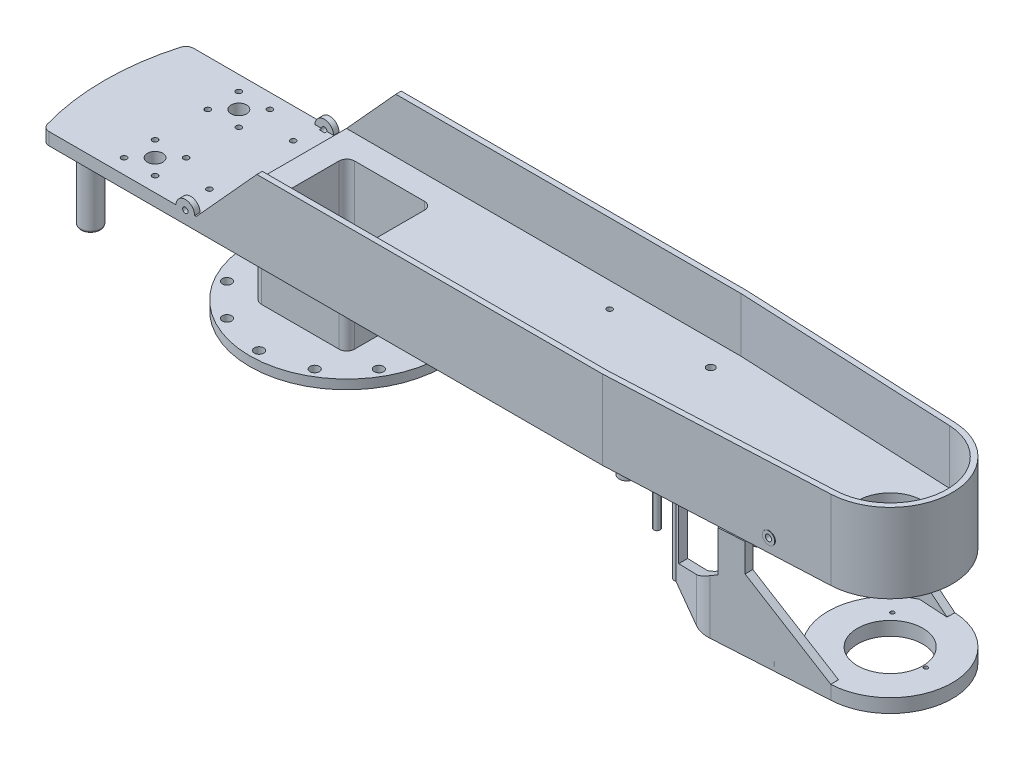
from build123d import *

# Parameters (mm, degrees)
BOSS_EXTRUDE1_DEPTH      = 16
SKETCH3_R                = 62.5
SKETCH3_R_2              = 48
EXTRUDE_THIN1_DEPTH      = 6
SKETCH4_R                = 48
BOSS_EXTRUDE2_DEPTH      = 3
BOSS_EXTRUDE3_REACH      = 399.256
SKETCH5_W                = 60
SKETCH5_H                = 60
FILLET1_R                = 5
SKETCH6_W                = 55
SKETCH6_H                = 55
CUT_EXTRUDE1_DEPTH       = 44
FILLET2_R                = 5
SKETCH7_R                = 26.5
CUT_EXTRUDE2_DEPTH       = 11.5
EXTRUDE_THIN2_DEPTH      = 35
CUT_EXTRUDE3_REACH       = 410.145
SKETCH10_R               = 1.75
CUT_EXTRUDE4_DEPTH       = 5
CUT_EXTRUDE5_REACH       = 407.892
SKETCH11_R               = 3
CIRPATTERN1_COUNT        = 12
BOSS_EXTRUDE4_DEPTH      = 3.5
SKETCH13_R               = 6.5
BOSS_EXTRUDE5_DEPTH      = 42.5
FILLET3_R                = 1.5
FILLET4_R                = 5
FILLET3_OF_MIRROR2_R     = 1.5
SKETCH14_R               = 25
CUT_EXTRUDE6_DEPTH       = 3.5
CUT_EXTRUDE7_REACH       = 399.822
SKETCH15_R               = 21
BOSS_EXTRUDE6_DEPTH      = 64
CUT_EXTRUDE8_DEPTH       = 401.127792086
CUT_EXTRUDE8_DEPTH_BACK  = 401.127792086
BOSS_EXTRUDE7_START      = -8.853542
SKETCH18_R               = 40
BOSS_EXTRUDE7_DEPTH      = 8.853542
SKETCH19_R               = 1
CUT_EXTRUDE9_DEPTH       = 6
CUT_EXTRUDE10_REACH      = 413.377
SKETCH20_R               = 21
CUT_EXTRUDE11_DEPTH      = 401.702508103
CUT_EXTRUDE11_DEPTH_BACK = 10
SKETCH21_R               = 1.25
BOSS_EXTRUDE8_DEPTH      = 2
BOSS_EXTRUDE8_DEPTH_BACK = 2
SKETCH23_R               = 9
SKETCH23_R_2             = 5
BOSS_EXTRUDE9_DEPTH      = 1
CUT_EXTRUDE13_REACH      = 403.485
SKETCH25_R               = 1.75
SKETCH26_R               = 5
BOSS_EXTRUDE10_DEPTH     = 0.8
FILLET6_R                = 5
SKETCH28_R               = 5
BOSS_EXTRUDE11_DEPTH     = 16
FILLET7_R                = 3
SKETCH29_R               = 1.75
CUT_EXTRUDE14_DEPTH      = 5
SKETCH30_R               = 2.5
BOSS_EXTRUDE12_DEPTH     = 16.8
FILLET8_R                = 1
CUT_EXTRUDE15_REACH      = 402.753
SKETCH31_R               = 1.75
CUT_EXTRUDE16_REACH      = 402.753
SKETCH32_R               = 2.5
SKETCH33_R               = 2
BOSS_EXTRUDE13_DEPTH     = 64
SKETCH34_R               = 1
CUT_EXTRUDE17_DEPTH      = 6
BOSS_EXTRUDE14_REACH     = 433.766
BOSS_EXTRUDE14_START     = -18
SKETCH35_R               = 4
SKETCH36_R               = 2
CUT_EXTRUDE18_DEPTH      = 4
SKETCH37_R               = 2
CUT_EXTRUDE19_DEPTH      = 2
MIRROR10_START           = -42
MIRROR10_OUTLINE_R       = 2
MIRROR10_DEPTH           = 4
MIRROR10_2_OUTLINE_R     = 4
MIRROR10_2_OUTLINE_R_2   = 2
MIRROR10_2_DEPTH         = 0.451198656
SKETCH38_R               = 5
CUT_EXTRUDE20_DEPTH      = 8


# Read off the part's stored shape, not the designer's step: Mirror10
with BuildPart() as part:
    # Sketch1 → Boss-Extrude1 (new body)
    with BuildSketch(Plane(origin=(0, 0, 0), x_dir=(1, 0, 0), z_dir=(0, 1, 0))):
        with BuildLine():
            Line((-148.90852897, 46.5), (211.09147103, 46.5))
            Line((211.09147103, 46.5), (351.857293256, 39.956857506))
            ThreePointArc((351.857293256, 39.956857506), (390, 0), (351.857293256, -39.956857506))
            Line((351.857293256, -39.956857506), (211.09147103, -46.5))
            Line((211.09147103, -46.5), (-148.90852897, -46.5))
            ThreePointArc((-148.90852897, -46.5), (-156, 0), (-148.90852897, 46.5))
        make_face()
    extrude(amount=BOSS_EXTRUDE1_DEPTH)


with BuildPart() as body_2:
    # Sketch3 → Extrude-Thin1 (new body)
    with BuildSketch(Plane(origin=(0, -36.5, 0), x_dir=(-1, 0, 0), z_dir=(0, -1, 0))):
        Circle(SKETCH3_R)
        Circle(SKETCH3_R_2, mode=Mode.SUBTRACT)
    extrude(amount=EXTRUDE_THIN1_DEPTH)

    # Sketch4 → Boss-Extrude2 (add)
    with BuildSketch(Plane(origin=(0, -36.5, 0), x_dir=(-1, 0, 0), z_dir=(0, -1, 0))):
        Circle(SKETCH4_R)
    extrude(amount=BOSS_EXTRUDE2_DEPTH)

    # Sketch5 → Boss-Extrude3 (add, up to next)
    with BuildSketch(Plane.XZ, mode=Mode.PRIVATE) as boss_extrude3_sk1:
        Rectangle(SKETCH5_W, SKETCH5_H)
    boss_extrude3_tool1 = extrude(boss_extrude3_sk1.sketch, amount=BOSS_EXTRUDE3_REACH, mode=Mode.PRIVATE) - body_2.part

    add(part.part)  # Boss-Extrude3 merges part
    add(boss_extrude3_tool1.solids().sort_by_distance((0, 0, 0))[0])

    # Fillet1
    fillet1_edges = [body_2.edges().sort_by_distance(p)[0] for p in [
        (30, -18.25, -30),
        (30, -18.25, 30),
        (-30, -18.25, 30),
        (-30, -18.25, -30),
    ]]
    fillet(fillet1_edges, radius=FILLET1_R)

    # Sketch6 → Cut-Extrude1 (cut)
    with BuildSketch(Plane(origin=(0, 16, 0), x_dir=(1, 0, 0), z_dir=(0, 1, 0))):
        Rectangle(SKETCH6_W, SKETCH6_H)
    extrude(amount=-CUT_EXTRUDE1_DEPTH, mode=Mode.SUBTRACT)

    # Fillet2
    fillet2_edges = [body_2.edges().sort_by_distance(p)[0] for p in [
        (27.5, -6, -27.5),
        (27.5, -6, 27.5),
        (-27.5, -6, 27.5),
        (-27.5, -6, -27.5),
    ]]
    fillet(fillet2_edges, radius=FILLET2_R)

    # Sketch7 → Cut-Extrude2 (cut)
    with BuildSketch(Plane.XZ.offset(39.5)):
        with Locations(Location((0, 0, 0), (0, 0, 270))):
            Circle(SKETCH7_R)
    extrude(amount=-CUT_EXTRUDE2_DEPTH, mode=Mode.SUBTRACT)

    # Sketch8 → Extrude-Thin2 (add)
    with BuildSketch(Plane(origin=(0, 16, 0), x_dir=(1, 0, 0), z_dir=(0, 1, 0))):
        with BuildLine():
            Line((351.857293256, 39.956857506), (211.09147103, 46.5))
            Line((211.09147103, 46.5), (-148.90852897, 46.5))
            ThreePointArc((-148.90852897, 46.5), (-156, 0), (-148.90852897, -46.5))
            Line((-148.90852897, -46.5), (211.09147103, -46.5))
            Line((211.09147103, -46.5), (351.857293256, -39.956857506))
            ThreePointArc((351.857293256, -39.956857506), (390, 0), (351.857293256, 39.956857506))
        make_face()
        with BuildLine():
            Line((351.694780096, 36.460632474), (211.010170606, 43))
            Line((211.010170606, 43), (-146.312166275, 43))
            ThreePointArc((-146.312166275, 43), (-152.5, 0), (-146.312166275, -43))
            Line((-146.312166275, -43), (211.010170606, -43))
            Line((211.010170606, -43), (351.694780096, -36.460632474))
            ThreePointArc((351.694780096, -36.460632474), (386.5, 0), (351.694780096, 36.460632474))
        make_face(mode=Mode.SUBTRACT)
    extrude(amount=EXTRUDE_THIN2_DEPTH)

    # Cut-Extrude3: up to this face of the body (flat: up to its plane)
    cut_extrude3_end = Plane(body_2.part.faces().sort_by_distance((31.09147103, 25.5, -46.5))[0])
    # Sketch9 → Cut-Extrude3 (cut, up to the picked face)
    with BuildSketch(Plane.XY.offset(46.5), mode=Mode.PRIVATE) as cut_extrude3_sk1:
        Polygon((-170.64581718, 8), (-50.48, 8), (5.323980372, 69.435391219), (-170.64581718, 69.435391219), align=None)
    cut_extrude3_tool1 = split(extrude(cut_extrude3_sk1.sketch, amount=-CUT_EXTRUDE3_REACH, mode=Mode.PRIVATE), bisect_by=cut_extrude3_end, keep=Keep.BOTH, mode=Mode.PRIVATE)
    add(cut_extrude3_tool1.solids().sort_by(Axis((-95.735602, 40.647183, 46.5), (0, 0, -1)))[0], mode=Mode.SUBTRACT)

    # Sketch10 → Cut-Extrude4 (cut)
    with BuildSketch(Plane(origin=(0, -28, 0), x_dir=(1, 0, 0), z_dir=(0, 1, 0))):
        with Locations(Location((21, 21, 0), (0, 0, 270))):
            Circle(SKETCH10_R)
        with Locations(Location((21, -21, 0), (0, 0, 270))):
            Circle(SKETCH10_R)
        with Locations(Location((-21, -21, 0), (0, 0, 270))):
            Circle(SKETCH10_R)
        with Locations(Location((-21, 21, 0), (0, 0, 270))):
            Circle(SKETCH10_R)
    extrude(amount=-CUT_EXTRUDE4_DEPTH, mode=Mode.SUBTRACT)

    # Sketch11 → Cut-Extrude5 (cut, up to next)
    with BuildSketch(Plane.XZ.offset(42.5), mode=Mode.PRIVATE) as cut_extrude5_sk1:
        with Locations(Location((56.5, 0, 0), (0, 0, 270))):
            Circle(SKETCH11_R)
    cut_extrude5_tool1 = extrude(cut_extrude5_sk1.sketch, amount=-CUT_EXTRUDE5_REACH, mode=Mode.PRIVATE) & body_2.part
    cut_extrude5 = cut_extrude5_tool1.solids().sort_by_distance((56.5, -42.5, 0))[0]
    add(cut_extrude5, mode=Mode.SUBTRACT)

    # CirPattern1: Cut-Extrude5 ×12 about axis
    cirpattern1_axis = Axis((0, 0, 0), (0, 1, 0))
    for i in range(1, CIRPATTERN1_COUNT):
        add(cut_extrude5.rotate(cirpattern1_axis, i * 360 / CIRPATTERN1_COUNT), mode=Mode.SUBTRACT)

    # Sketch12 → Boss-Extrude4 (add)
    with BuildSketch(Plane.XY.offset(46.5)):
        with BuildLine():
            Line((-63.5, 8), (-51.5, 8))
            ThreePointArc((-51.5, 8), (-57.5, 14), (-63.5, 8))
        make_face()
    boss_extrude4 = extrude(amount=-BOSS_EXTRUDE4_DEPTH)

    # Mirror1: Boss-Extrude4 across plane
    add(boss_extrude4.mirror(Plane.XY))

    # Sketch13 → Boss-Extrude5 (add)
    with BuildSketch(Plane.XZ):
        with Locations(Location((-130, 35, 0), (0, 0, 90))):
            Circle(SKETCH13_R)
    boss_extrude5 = extrude(amount=BOSS_EXTRUDE5_DEPTH)

    # Fillet3
    fillet3_edges = [body_2.edges().sort_by_distance(p)[0] for p in [
        (-130, -42.5, 28.5),
    ]]
    fillet(fillet3_edges, radius=FILLET3_R)

    # Fillet4
    fillet4_edges = [body_2.edges().sort_by_distance(p)[0] for p in [
        (-148.90852897, 4, -46.5),
        (-148.90852897, 4, 46.5),
    ]]
    fillet(fillet4_edges, radius=FILLET4_R)

    # Mirror2: Boss-Extrude5 across plane
    add(boss_extrude5.mirror(Plane.XY))

    # Fillet3 of Mirror2
    fillet3_of_mirror2_edges = [body_2.edges().sort_by_distance(p)[0] for p in [
        (-130, -42.5, -28.5),
    ]]
    fillet(fillet3_of_mirror2_edges, radius=FILLET3_OF_MIRROR2_R)

    # Sketch14 → Cut-Extrude6 (cut)
    with BuildSketch(Plane.XZ):
        with Locations(Location((350, 0, 0), (0, 0, 270))):
            Circle(SKETCH14_R)
    extrude(amount=-CUT_EXTRUDE6_DEPTH, mode=Mode.SUBTRACT)

    # Sketch15 → Cut-Extrude7 (cut, up to next)
    with BuildSketch(Plane.XZ.offset(-3.5), mode=Mode.PRIVATE) as cut_extrude7_sk1:
        with Locations(Location((350, 0, 0), (0, 0, 270))):
            Circle(SKETCH15_R)
    cut_extrude7_tool1 = extrude(cut_extrude7_sk1.sketch, amount=-CUT_EXTRUDE7_REACH, mode=Mode.PRIVATE) & body_2.part
    add(cut_extrude7_tool1.solids().sort_by_distance((350, 3.5, 0))[0], mode=Mode.SUBTRACT)

    # Sketch16 → Boss-Extrude6 (add)
    with BuildSketch(Plane.XZ):
        with BuildLine():
            Line((351.857293256, 39.956857506), (278.143743734, 44.309161633))
            ThreePointArc((278.143743734, 44.309161633), (272.360368874, 43.806666785), (266.964927199, 41.664440144))
            Line((266.964927199, 41.664440144), (235.621320344, 23.568200289))
            ThreePointArc((235.621320344, 23.568200289), (231.718911087, 18.428391908), (238.121320344, 19.23807327))
            Line((238.121320344, 19.23807327), (268.166690967, 36.584776088))
            ThreePointArc((268.166690967, 36.584776088), (273.562132642, 38.727002728), (279.345507503, 39.229497577))
            Line((279.345507503, 39.229497577), (351.562589122, 34.965550115))
            Line((351.562589122, 34.965550115), (351.857293256, 39.956857506))
        make_face()
        with BuildLine():
            Line((351.857293256, -39.956857506), (351.562589122, -34.965550115))
            Line((351.562589122, -34.965550115), (279.345507503, -39.229497577))
            ThreePointArc((279.345507503, -39.229497577), (273.562132642, -38.727002728), (268.166690967, -36.584776088))
            Line((268.166690967, -36.584776088), (238.121320344, -19.23807327))
            ThreePointArc((238.121320344, -19.23807327), (231.718911087, -18.428391908), (235.621320344, -23.568200289))
            Line((235.621320344, -23.568200289), (266.964927199, -41.664440144))
            ThreePointArc((266.964927199, -41.664440144), (272.360368874, -43.806666785), (278.143743734, -44.309161633))
            Line((278.143743734, -44.309161633), (351.857293256, -39.956857506))
        make_face()
    extrude(amount=BOSS_EXTRUDE6_DEPTH)

    # Sketch17 → Cut-Extrude8 (cut, two sides: drawn at the far end of the back side and taken through both)
    with BuildSketch(Plane.XY.offset(-CUT_EXTRUDE8_DEPTH_BACK)):
        Polygon((299.57623477, 0), (368.485150603, 0), (368.485150603, -55.251157242), (351.857293256, -55.251157242), (299.57623477, -18.10349372), align=None)
        Polygon((239.768496501, 0), (283.231262821, 0), (283.231262821, -26.263995201), (239.768496501, -50.781453125), align=None)
    extrude(amount=CUT_EXTRUDE8_DEPTH + CUT_EXTRUDE8_DEPTH_BACK, mode=Mode.SUBTRACT)

    # Sketch18 → Boss-Extrude7 (add)
    with BuildSketch(Plane.XZ.offset(64).offset(BOSS_EXTRUDE7_START)):
        with Locations((350, 0)):
            Circle(SKETCH18_R)
    extrude(amount=BOSS_EXTRUDE7_DEPTH)

    # Sketch19 → Cut-Extrude9 (cut)
    with BuildSketch(Plane.XZ.offset(64)):
        with Locations(Location((234.75, -20.178391908, 0), (0, 0, 270))):
            Circle(SKETCH19_R)
        with Locations(Location((234.75, 20.178391908, 0), (0, 0, 270))):
            Circle(SKETCH19_R)
    extrude(amount=-CUT_EXTRUDE9_DEPTH, mode=Mode.SUBTRACT)

    # Sketch20 → Cut-Extrude10 (cut, up to next)
    with BuildSketch(Plane.XZ.offset(64), mode=Mode.PRIVATE) as cut_extrude10_sk1:
        with Locations(Location((350, 0, 0), (0, 0, 270))):
            Circle(SKETCH20_R)
    cut_extrude10_tool1 = extrude(cut_extrude10_sk1.sketch, amount=-CUT_EXTRUDE10_REACH, mode=Mode.PRIVATE) & body_2.part
    add(cut_extrude10_tool1.solids().sort_by_distance((350, -64, 0))[0], mode=Mode.SUBTRACT)

    # Sketch21 → Cut-Extrude11 (cut, two sides: drawn at the far end of the back side and taken through both)
    with BuildSketch(Plane.XZ.offset(-3.5).offset(-CUT_EXTRUDE11_DEPTH_BACK)):
        with Locations(Location((373, 0, 0), (0, 0, 270))):
            Circle(SKETCH21_R)
        with Locations(Location((331.5, -19.918584287, 0), (0, 0, 270))):
            Circle(SKETCH21_R)
        with Locations(Location((293.5, 6.062177826, 0), (0, 0, 90))):
            Circle(SKETCH21_R)
        with Locations((297, 51.961524227)):
            Circle(SKETCH21_R)
        with Locations((338.5, 71.880108514)):
            Circle(SKETCH21_R)
        with Locations((376.5, 45.899346401)):
            Circle(SKETCH21_R)
    extrude(amount=CUT_EXTRUDE11_DEPTH + CUT_EXTRUDE11_DEPTH_BACK, mode=Mode.SUBTRACT)

    # Sketch22 → Boss-Extrude8 (add, two sides: drawn at the far end of the back side and taken through both)
    with BuildSketch(Plane.XY.offset(-BOSS_EXTRUDE8_DEPTH_BACK)):
        Polygon((-140.988978829, 0), (-30, 0), (-30, -5.92459278), align=None)
    extrude(amount=BOSS_EXTRUDE8_DEPTH + BOSS_EXTRUDE8_DEPTH_BACK)

    # Sketch23 → Boss-Extrude9 (add)
    with BuildSketch(Plane.XZ):
        with Locations(Location((-96.52, 26.97, 0), (0, 0, 90))):
            Circle(SKETCH23_R)
        with Locations(Location((-96.52, 26.97, 0), (0, 0, 270))):
            Circle(SKETCH23_R_2, mode=Mode.SUBTRACT)
    boss_extrude9 = extrude(amount=BOSS_EXTRUDE9_DEPTH)

    # Mirror3: Boss-Extrude9 across plane
    add(boss_extrude9.mirror(Plane.XY))

    # Sketch25 → Cut-Extrude13 (cut, up to next)
    with BuildSketch(Plane(origin=(0, 8, 0), x_dir=(1, 0, 0), z_dir=(0, 1, 0)), mode=Mode.PRIVATE) as cut_extrude13_sk1:
        with Locations(Location((-86.52, -16.97, 0), (0, 0, 270))):
            Circle(SKETCH25_R)
    cut_extrude13_tool1 = extrude(cut_extrude13_sk1.sketch, amount=-CUT_EXTRUDE13_REACH, mode=Mode.PRIVATE) & body_2.part
    # Sketch25 → Cut-Extrude13 (cut, up to next)
    with BuildSketch(Plane(origin=(0, 8, 0), x_dir=(1, 0, 0), z_dir=(0, 1, 0)), mode=Mode.PRIVATE) as cut_extrude13_sk2:
        with Locations(Location((-86.52, -36.97, 0), (0, 0, 270))):
            Circle(SKETCH25_R)
    cut_extrude13_tool2 = extrude(cut_extrude13_sk2.sketch, amount=-CUT_EXTRUDE13_REACH, mode=Mode.PRIVATE) & body_2.part
    # Sketch25 → Cut-Extrude13 (cut, up to next)
    with BuildSketch(Plane(origin=(0, 8, 0), x_dir=(1, 0, 0), z_dir=(0, 1, 0)), mode=Mode.PRIVATE) as cut_extrude13_sk3:
        with Locations(Location((-106.52, -36.97, 0), (0, 0, 270))):
            Circle(SKETCH25_R)
    cut_extrude13_tool3 = extrude(cut_extrude13_sk3.sketch, amount=-CUT_EXTRUDE13_REACH, mode=Mode.PRIVATE) & body_2.part
    # Sketch25 → Cut-Extrude13 (cut, up to next)
    with BuildSketch(Plane(origin=(0, 8, 0), x_dir=(1, 0, 0), z_dir=(0, 1, 0)), mode=Mode.PRIVATE) as cut_extrude13_sk4:
        with Locations(Location((-106.52, -16.97, 0), (0, 0, 270))):
            Circle(SKETCH25_R)
    cut_extrude13_tool4 = extrude(cut_extrude13_sk4.sketch, amount=-CUT_EXTRUDE13_REACH, mode=Mode.PRIVATE) & body_2.part
    cut_extrude13_1 = cut_extrude13_tool1.solids().sort_by_distance((-86.52, 8, 16.97))[0]
    add(cut_extrude13_1, mode=Mode.SUBTRACT)
    cut_extrude13_2 = cut_extrude13_tool2.solids().sort_by_distance((-86.52, 8, 36.97))[0]
    add(cut_extrude13_2, mode=Mode.SUBTRACT)
    cut_extrude13_3 = cut_extrude13_tool3.solids().sort_by_distance((-106.52, 8, 36.97))[0]
    add(cut_extrude13_3, mode=Mode.SUBTRACT)
    cut_extrude13_4 = cut_extrude13_tool4.solids().sort_by_distance((-106.52, 8, 16.97))[0]
    add(cut_extrude13_4, mode=Mode.SUBTRACT)
    cut_extrude13 = cut_extrude13_1 + cut_extrude13_2 + cut_extrude13_3 + cut_extrude13_4  # Cut-Extrude13 as one shape, for the pattern or mirror that repeats it

    # Mirror4: Cut-Extrude13 across plane
    add(cut_extrude13.mirror(Plane.XY), mode=Mode.SUBTRACT)

    # Sketch26 → Boss-Extrude10 (add)
    with BuildSketch(Plane.XZ):
        with Locations(Location((207.42, 27, 0), (0, 0, 90))):
            Circle(SKETCH26_R)
        with Locations(Location((207.42, -27, 0), (0, 0, 90))):
            Circle(SKETCH26_R)
    extrude(amount=BOSS_EXTRUDE10_DEPTH)

    # Fillet6
    # the kernel refuses this fillet: 5 mm, written as the material it adds along each edge
    with BuildSketch(Plane(origin=(207.42, 0, 27), x_dir=(0, 0, 1), z_dir=(1, 0, 0))) as fillet6_piece_1:
        with BuildLine():
            CenterArc((7.712931993, 5), FILLET6_R, 237.140119621, 32.859880379)
            Line((5, 0.8), (4.94574136, 0.716))
            ThreePointArc((4.94574136, 0.716), (4.9, 0.4), (4.9, 0))
            Line((4.9, 0), (5, -0.1))
            Line((5, -0.1), (7.712931993, -0.1))
            Line((7.712931993, -0.1), (7.712931993, 0))
        make_face()
    revolve(axis=Axis((207.42, 0, 27), (0, -1, 0)))
    with BuildSketch(Plane(origin=(207.42, 0, -27), x_dir=(0, 0, 1), z_dir=(1, 0, 0))) as fillet6_piece_2:
        with BuildLine():
            CenterArc((7.712931993, 5), FILLET6_R, 237.140119621, 32.859880379)
            Line((5, 0.8), (4.94574136, 0.716))
            ThreePointArc((4.94574136, 0.716), (4.9, 0.4), (4.9, 0))
            Line((4.9, 0), (5, -0.1))
            Line((5, -0.1), (7.712931993, -0.1))
            Line((7.712931993, -0.1), (7.712931993, 0))
        make_face()
    revolve(axis=Axis((207.42, 0, -27), (0, -1, 0)))

    # Sketch28 → Boss-Extrude11 (add)
    with BuildSketch(Plane.XZ.offset(0.8)):
        with Locations(Location((207.42, -27, 0), (0, 0, 270))):
            Circle(SKETCH28_R)
        with Locations(Location((207.42, 27, 0), (0, 0, 270))):
            Circle(SKETCH28_R)
    extrude(amount=BOSS_EXTRUDE11_DEPTH)

    # Fillet7
    # the kernel refuses this fillet: 3 mm, written as the material it adds along each edge
    with BuildSketch(Plane(origin=(-96.52, 0, 26.97), x_dir=(0, 0, 1), z_dir=(1, 0, 0))) as fillet7_piece_1:
        with BuildLine():
            CenterArc((11.236067977, 3), FILLET7_R, 221.810314896, 48.189685104)
            Line((9, 1), (8.95527864, 0.96))
            ThreePointArc((8.95527864, 0.96), (8.94, 0.5), (8.94, 0))
            Line((8.94, 0), (9, -0.06))
            Line((9, -0.06), (11.236067977, -0.06))
            Line((11.236067977, -0.06), (11.236067977, 0))
        make_face()
    revolve(axis=Axis((-96.52, 0, 26.97), (0, -1, 0)))
    with BuildSketch(Plane(origin=(-96.52, 0, -26.97), x_dir=(0, 0, -1), z_dir=(1, 0, 0))) as fillet7_piece_2:
        with BuildLine():
            CenterArc((11.236067977, -3), FILLET7_R, 90, 48.189685104)
            Line((9, -1), (8.95527864, -0.96))
            ThreePointArc((8.95527864, -0.96), (8.94, -0.5), (8.94, 0))
            Line((8.94, 0), (9, 0.06))
            Line((9, 0.06), (11.236067977, 0.06))
            Line((11.236067977, 0.06), (11.236067977, 0))
        make_face()
    revolve(axis=Axis((-96.52, 0, -26.97), (0, 1, 0)))

    # Sketch29 → Cut-Extrude14 (cut)
    with BuildSketch(Plane.XY.offset(46.5)):
        with Locations((-57.5, 8)):
            Circle(SKETCH29_R)
    cut_extrude14 = extrude(amount=-CUT_EXTRUDE14_DEPTH, mode=Mode.SUBTRACT)

    # Sketch30 → Boss-Extrude12 (add)
    with BuildSketch(Plane.XZ):
        with Locations(Location((-61.52, 26.97, 0), (0, 0, 90))):
            Circle(SKETCH30_R)
        with Locations(Location((142.32, 26.97, 0), (0, 0, 90))):
            Circle(SKETCH30_R)
    boss_extrude12 = extrude(amount=BOSS_EXTRUDE12_DEPTH)

    # Mirror5: Boss-Extrude12 across plane
    add(boss_extrude12.mirror(Plane.XY))

    # Fillet8
    fillet8_edges = [body_2.edges().sort_by_distance(p)[0] for p in [
        (-61.52, 0, 24.47),
        (142.32, 0, 24.47),
        (-61.52, 0, -24.47),
        (142.32, 0, -24.47),
    ]]
    fillet(fillet8_edges, radius=FILLET8_R)

    # Sketch31 → Cut-Extrude15 (cut, up to next)
    with BuildSketch(Plane.XZ.offset(16.8), mode=Mode.PRIVATE) as cut_extrude15_sk1:
        with Locations(Location((-61.52, 26.97, 0), (0, 0, 270))):
            Circle(SKETCH31_R)
    cut_extrude15_tool1 = extrude(cut_extrude15_sk1.sketch, amount=-CUT_EXTRUDE15_REACH, mode=Mode.PRIVATE) & body_2.part
    # Sketch31 → Cut-Extrude15 (cut, up to next)
    with BuildSketch(Plane.XZ.offset(16.8), mode=Mode.PRIVATE) as cut_extrude15_sk2:
        with Locations(Location((-61.52, -26.97, 0), (0, 0, 270))):
            Circle(SKETCH31_R)
    cut_extrude15_tool2 = extrude(cut_extrude15_sk2.sketch, amount=-CUT_EXTRUDE15_REACH, mode=Mode.PRIVATE) & body_2.part
    # Sketch31 → Cut-Extrude15 (cut, up to next)
    with BuildSketch(Plane.XZ.offset(16.8), mode=Mode.PRIVATE) as cut_extrude15_sk3:
        with Locations(Location((142.32, 26.97, 0), (0, 0, 270))):
            Circle(SKETCH31_R)
    cut_extrude15_tool3 = extrude(cut_extrude15_sk3.sketch, amount=-CUT_EXTRUDE15_REACH, mode=Mode.PRIVATE) & body_2.part
    # Sketch31 → Cut-Extrude15 (cut, up to next)
    with BuildSketch(Plane.XZ.offset(16.8), mode=Mode.PRIVATE) as cut_extrude15_sk4:
        with Locations(Location((142.32, -26.97, 0), (0, 0, 270))):
            Circle(SKETCH31_R)
    cut_extrude15_tool4 = extrude(cut_extrude15_sk4.sketch, amount=-CUT_EXTRUDE15_REACH, mode=Mode.PRIVATE) & body_2.part
    add(cut_extrude15_tool1.solids().sort_by_distance((-61.52, -16.8, 26.97))[0], mode=Mode.SUBTRACT)
    add(cut_extrude15_tool2.solids().sort_by_distance((-61.52, -16.8, -26.97))[0], mode=Mode.SUBTRACT)
    add(cut_extrude15_tool3.solids().sort_by_distance((142.32, -16.8, 26.97))[0], mode=Mode.SUBTRACT)
    add(cut_extrude15_tool4.solids().sort_by_distance((142.32, -16.8, -26.97))[0], mode=Mode.SUBTRACT)

    # Sketch32 → Cut-Extrude16 (cut, up to next)
    with BuildSketch(Plane.XZ.offset(16.8), mode=Mode.PRIVATE) as cut_extrude16_sk1:
        with Locations(Location((207.42, 27, 0), (0, 0, 270))):
            Circle(SKETCH32_R)
    cut_extrude16_tool1 = extrude(cut_extrude16_sk1.sketch, amount=-CUT_EXTRUDE16_REACH, mode=Mode.PRIVATE) & body_2.part
    # Sketch32 → Cut-Extrude16 (cut, up to next)
    with BuildSketch(Plane.XZ.offset(16.8), mode=Mode.PRIVATE) as cut_extrude16_sk2:
        with Locations(Location((207.42, -27, 0), (0, 0, 270))):
            Circle(SKETCH32_R)
    cut_extrude16_tool2 = extrude(cut_extrude16_sk2.sketch, amount=-CUT_EXTRUDE16_REACH, mode=Mode.PRIVATE) & body_2.part
    add(cut_extrude16_tool1.solids().sort_by_distance((207.42, -16.8, 27))[0], mode=Mode.SUBTRACT)
    add(cut_extrude16_tool2.solids().sort_by_distance((207.42, -16.8, -27))[0], mode=Mode.SUBTRACT)

    # Mirror6: Cut-Extrude14 across plane
    add(cut_extrude14.mirror(Plane.XY), mode=Mode.SUBTRACT)

    # Sketch33 → Boss-Extrude13 (add)
    with BuildSketch(Plane.XZ):
        with Locations(Location((199.8, 0, 0), (0, 0, 90))):
            Circle(SKETCH33_R)
    extrude(amount=BOSS_EXTRUDE13_DEPTH)

    # Sketch34 → Cut-Extrude17 (cut)
    with BuildSketch(Plane.XZ.offset(64)):
        with Locations(Location((199.8, 0, 0), (0, 0, 270))):
            Circle(SKETCH34_R)
    extrude(amount=-CUT_EXTRUDE17_DEPTH, mode=Mode.SUBTRACT)

    # Sketch36 → Cut-Extrude18 (cut)
    with BuildSketch(Plane.XY.offset(42)):
        with Locations((313.609025305, 8.5)):
            Circle(SKETCH36_R)
        with Locations((313.609025305, -60)):
            Circle(SKETCH36_R)
    extrude(amount=-CUT_EXTRUDE18_DEPTH, mode=Mode.SUBTRACT)

    # Mirror10 outline → Mirror10 (cut)
    with BuildSketch(Plane.XY.offset(MIRROR10_START)):
        with Locations((313.609025305, 8.5)):
            Circle(MIRROR10_OUTLINE_R)
        with Locations((313.609025305, -60)):
            Circle(MIRROR10_OUTLINE_R)
    extrude(amount=MIRROR10_DEPTH, mode=Mode.SUBTRACT)

    # Mirror10 2 outline → Mirror10 2 (add)
    # profile 1 of 2: a face of its own
    with BuildSketch(Plane.XY.offset(MIRROR10_START)):
        with Locations((313.609025305, 8.5)):
            Circle(MIRROR10_2_OUTLINE_R)
        with Locations((313.609025305, 8.5)):
            Circle(MIRROR10_2_OUTLINE_R_2, mode=Mode.SUBTRACT)
    # profile 2 of 2: a face of its own
    with BuildSketch(Plane.XY.offset(MIRROR10_START)):
        with BuildLine():
            ThreePointArc((317.253258014, -61.649111263), (317.609025305, -60), (317.253258014, -58.350888737))
            Line((317.253258014, -58.350888737), (309, -40.112705888))
            Line((309, -40.112705888), (309, -63))
            Line((309, -63), (316.641945287, -63))
            Line((316.641945287, -63), (317.253258014, -61.649111263))
        make_face()
        with Locations((313.609025305, -60)):
            Circle(MIRROR10_2_OUTLINE_R_2, mode=Mode.SUBTRACT)
    extrude(amount=MIRROR10_2_DEPTH)

    # Sketch38 → Cut-Extrude20 (cut)
    with BuildSketch(Plane.XZ):
        with Locations(Location((-96.52, 26.97, 0), (0, 0, 270))):
            Circle(SKETCH38_R)
        with Locations(Location((-96.52, -26.97, 0), (0, 0, 90))):
            Circle(SKETCH38_R)
    extrude(amount=-CUT_EXTRUDE20_DEPTH, mode=Mode.SUBTRACT)


with BuildPart() as body_2_2:
    # Boss-Extrude14: up to this plane
    boss_extrude14_end = Plane(origin=(211.09147103, 16, 46.5), z_dir=(-0.04643233139573556, 0, -0.9989214376522093))
    # Sketch35 → Boss-Extrude14 (new, up to the surface)
    with BuildSketch(Plane.XY.offset(60).offset(BOSS_EXTRUDE14_START), mode=Mode.PRIVATE) as boss_extrude14_sk1:
        with Locations((313.609025305, -60)):
            Circle(SKETCH35_R)
    boss_extrude14_tool1 = split(extrude(boss_extrude14_sk1.sketch, amount=-BOSS_EXTRUDE14_REACH, mode=Mode.PRIVATE), bisect_by=boss_extrude14_end, keep=Keep.BOTH, mode=Mode.PRIVATE)
    add(boss_extrude14_tool1.solids().sort_by_distance((313.609025, -60, 42))[0])
    # Sketch35 → Boss-Extrude14 (new, up to the surface)
    with BuildSketch(Plane.XY.offset(60).offset(BOSS_EXTRUDE14_START), mode=Mode.PRIVATE) as boss_extrude14_sk2:
        with Locations((313.609025305, 8.5)):
            Circle(SKETCH35_R)
    boss_extrude14_tool2 = split(extrude(boss_extrude14_sk2.sketch, amount=-BOSS_EXTRUDE14_REACH, mode=Mode.PRIVATE), bisect_by=boss_extrude14_end, keep=Keep.BOTH, mode=Mode.PRIVATE)
    add(boss_extrude14_tool2.solids().sort_by_distance((313.609025, 8.5, 42))[0])

    # Sketch37 → Cut-Extrude19 (cut)
    with BuildSketch(Plane.XY.offset(42)):
        with Locations((313.609025305, 8.5)):
            Circle(SKETCH37_R)
        with Locations((313.609025305, -60)):
            Circle(SKETCH37_R)
    extrude(amount=-CUT_EXTRUDE19_DEPTH, mode=Mode.SUBTRACT)


solid = Compound([body_2.part, body_2_2.part])
